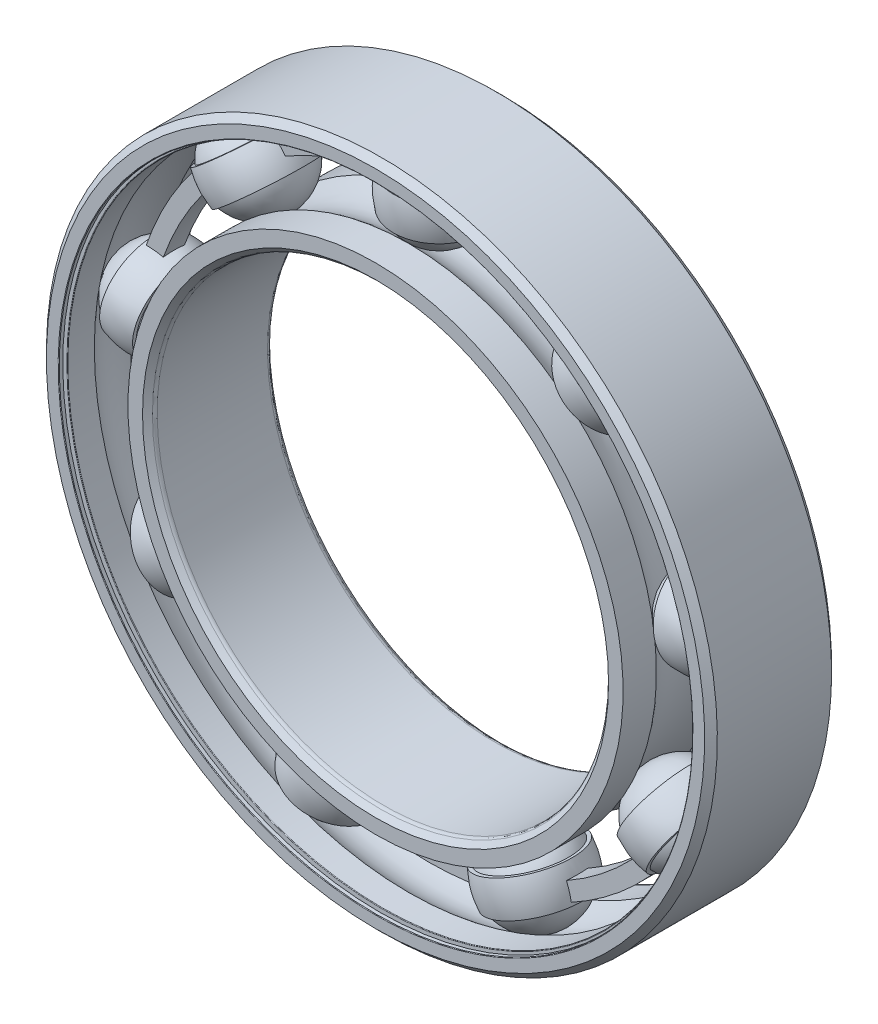
from build123d import *

# Parameters (mm, degrees)
BOSS_EXTRUDE1_DEPTH = 0.583333333
CIRPATTERN1_COUNT   = 9
CIRPATTERN2_COUNT   = 9
FILLET1_R           = 0.0315
FILLET2_R           = 0.2625


with BuildPart() as part:
    # Sketch3 → Revolve1 (revolve)
    with BuildSketch(Plane(origin=(0, 0, 0), x_dir=(0, 0, -1), z_dir=(1, 0, 0)), mode=Mode.PRIVATE) as revolve1_sk:
        with BuildLine():
            Line((3.15, 18.5), (3.5, 18.15))
            Line((3.5, 18.15), (3.5, 17.346153846))
            Line((3.5, 17.346153846), (1.6625, 17.346153846))
            ThreePointArc((1.6625, 17.346153846), (0, 17.984389316), (-1.6625, 17.346153846))
            Line((-1.6625, 17.346153846), (-3.5, 17.346153846))
            Line((-3.5, 17.346153846), (-3.5, 18.15))
            Line((-3.5, 18.15), (-3.15, 18.5))
            Line((-3.15, 18.5), (3.15, 18.5))
        make_face()
    revolve(revolve1_sk.sketch.rotate(Axis((0, 0, 3.5), (0, 0, -1)), 180), axis=Axis((0, 0, 3.5), (0, 0, -1)))

    # Sketch8 → Cut-Revolve1 (revolve, cut)
    with BuildSketch(Plane(origin=(0, 0, 0), x_dir=(0, 0, -1), z_dir=(1, 0, 0)), mode=Mode.PRIVATE) as cut_revolve1_sk:
        Polygon((-3.276, 17.346153846), (-3.15, 17.346153846), (-3.15, 17.730769231), (-3.276, 17.730769231), (-3.276, 17.472153846), (-3.5, 17.472153846), (-3.5, 17.346153846), align=None)
        Polygon((3.15, 17.346153846), (3.276, 17.346153846), (3.5, 17.346153846), (3.5, 17.472153846), (3.276, 17.472153846), (3.276, 17.730769231), (3.15, 17.730769231), align=None)
    revolve(cut_revolve1_sk.sketch.rotate(Axis((0, 0, 3.5), (0, 0, -1)), 180), axis=Axis((0, 0, 3.5), (0, 0, -1)), mode=Mode.SUBTRACT)

    # Fillet1
    fillet1_edges = [part.edges().sort_by_distance(p)[0] for p in [
        (0, 17.472153846, 3.5),
        (0, 17.346153846, 3.15),
        (0, 17.472153846, -3.5),
        (0, 17.346153846, -3.15),
    ]]
    fillet(fillet1_edges, radius=FILLET1_R)


with BuildPart() as body_2:
    # Sketch4 → Revolve2 (revolve)
    with BuildSketch(Plane(origin=(0, 0, 0), x_dir=(0, 0, -1), z_dir=(1, 0, 0)), mode=Mode.PRIVATE) as revolve2_sk:
        with BuildLine():
            Line((-3.15, 12.5), (-3.5, 12.85))
            Line((-3.5, 12.85), (-3.5, 13.653846154))
            Line((-3.5, 13.653846154), (-1.6625, 13.653846154))
            ThreePointArc((-1.6625, 13.653846154), (0, 13.015610684), (1.6625, 13.653846154))
            Line((1.6625, 13.653846154), (3.5, 13.653846154))
            Line((3.5, 13.653846154), (3.5, 12.85))
            Line((3.5, 12.85), (3.15, 12.5))
            Line((3.15, 12.5), (-3.15, 12.5))
        make_face()
    revolve(revolve2_sk.sketch.rotate(Axis((0, 0, 3.5), (0, 0, -1)), 180), axis=Axis((0, 0, 3.5), (0, 0, -1)))

    # Fillet2
    fillet2_edges = [body_2.edges().sort_by_distance(p)[0] for p in [
        (0, 12.5, 3.15),
        (0, 12.5, -3.15),
    ]]
    fillet(fillet2_edges, radius=FILLET2_R)


with BuildPart() as body_3:
    # Sketch5 → Revolve3 (revolve)
    with BuildSketch(Plane(origin=(0, 0, 0), x_dir=(0, 0, -1), z_dir=(1, 0, 0))):
        with BuildLine():
            Line((-2.484389316, 15.5), (2.484389316, 15.5))
            ThreePointArc((2.484389316, 15.5), (0, 17.984389316), (-2.484389316, 15.5))
        make_face()
    revolve(axis=Axis((0, 15.5, 2.484389316), (0, 0, -1)))


with BuildPart() as body_4:
    # Sketch6 → Revolve4 (revolve)
    with BuildSketch(Plane(origin=(0, 0, 0), x_dir=(0, 0, -1), z_dir=(1, 0, 0))):
        with BuildLine():
            Line((-2.306538373, 16.423076923), (-2.505448644, 16.423076923))
            ThreePointArc((-2.505448644, 16.423076923), (-2.60490378, 15.5), (-2.505448644, 14.576923077))
            Line((-2.505448644, 14.576923077), (-2.306538373, 14.576923077))
            ThreePointArc((-2.306538373, 14.576923077), (-2.484389316, 15.5), (-2.306538373, 16.423076923))
        make_face()
    revolve4 = revolve(axis=Axis((0, 18.5, 0), (0, -1, 0)))

    # Sketch7 → Boss-Extrude1 (add, symmetric)
    with BuildSketch(Plane.XY):
        with BuildLine():
            Line((9.642968818, 12.135203022), (10.217239914, 12.857895013))
            ThreePointArc((10.217239914, 12.857895013), (5.410695739, 15.506186741), (0, 16.423076923))
            Line((0, 16.423076923), (0, 15.5))
            ThreePointArc((0, 15.5), (5.106581692, 14.634644629), (9.642968818, 12.135203022))
        make_face()
    boss_extrude1 = extrude(amount=BOSS_EXTRUDE1_DEPTH, both=True)

    # CirPattern2: Revolve4, Boss-Extrude1 ×9 about axis
    cirpattern2_axis = Axis((0, 0, 0), (0, 0, 1))
    add([revolve4.rotate(cirpattern2_axis, i * 360 / CIRPATTERN2_COUNT) for i in range(1, CIRPATTERN2_COUNT)])
    add([boss_extrude1.rotate(cirpattern2_axis, i * 360 / CIRPATTERN2_COUNT) for i in range(1, CIRPATTERN2_COUNT)])


with BuildPart() as cirpattern1_1:
    # CirPattern1: pattern copy
    add(body_3.part.rotate(Axis((0, 0, 0), (0, 0, 1)), 1 * 360 / CIRPATTERN1_COUNT))


with BuildPart() as cirpattern1_2:
    # CirPattern1: pattern copy
    add(body_3.part.rotate(Axis((0, 0, 0), (0, 0, 1)), 2 * 360 / CIRPATTERN1_COUNT))


with BuildPart() as cirpattern1_3:
    # CirPattern1: pattern copy
    add(body_3.part.rotate(Axis((0, 0, 0), (0, 0, 1)), 3 * 360 / CIRPATTERN1_COUNT))


with BuildPart() as cirpattern1_4:
    # CirPattern1: pattern copy
    add(body_3.part.rotate(Axis((0, 0, 0), (0, 0, 1)), 4 * 360 / CIRPATTERN1_COUNT))


with BuildPart() as cirpattern1_5:
    # CirPattern1: pattern copy
    add(body_3.part.rotate(Axis((0, 0, 0), (0, 0, 1)), 5 * 360 / CIRPATTERN1_COUNT))


with BuildPart() as cirpattern1_6:
    # CirPattern1: pattern copy
    add(body_3.part.rotate(Axis((0, 0, 0), (0, 0, 1)), 6 * 360 / CIRPATTERN1_COUNT))


with BuildPart() as cirpattern1_7:
    # CirPattern1: pattern copy
    add(body_3.part.rotate(Axis((0, 0, 0), (0, 0, 1)), 7 * 360 / CIRPATTERN1_COUNT))


with BuildPart() as cirpattern1_8:
    # CirPattern1: pattern copy
    add(body_3.part.rotate(Axis((0, 0, 0), (0, 0, 1)), 8 * 360 / CIRPATTERN1_COUNT))


solid = Compound([part.part, body_2.part, body_3.part, body_4.part, cirpattern1_1.part, cirpattern1_2.part, cirpattern1_3.part, cirpattern1_4.part, cirpattern1_5.part, cirpattern1_6.part, cirpattern1_7.part, cirpattern1_8.part])
